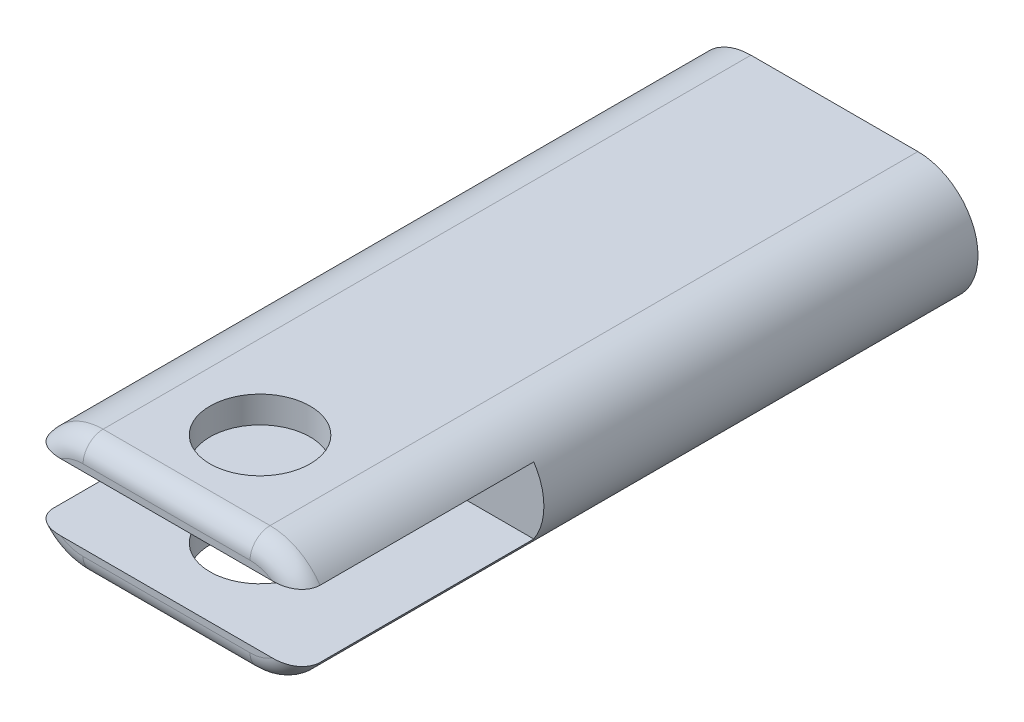
from build123d import *

# Parameters (mm, degrees)
BOSS_EXTRUDE1_DEPTH = 1000
FILLET1_R           = 30
SKETCH2_W           = 431.388380784
SKETCH2_H           = 100
CUT_EXTRUDE1_DEPTH  = 350
SKETCH3_R           = 75
CUT_EXTRUDE2_DEPTH  = 1039.568726775


with BuildPart() as part:
    # Sketch1 → Boss-Extrude1 (new body)
    with BuildSketch(Plane.XY):
        with BuildLine():
            Line((-125, 90), (125, 90))
            ThreePointArc((125, 90), (215, 0), (125, -90))
            Line((125, -90), (-125, -90))
            ThreePointArc((-125, -90), (-215, 0), (-125, 90))
        make_face()
    extrude(amount=BOSS_EXTRUDE1_DEPTH)

    # Fillet1
    fillet1_edges = [part.edges().sort_by_distance(p)[0] for p in [
        (-215, 0, 1000),
        (215, 0, 1000),
        (0, 90, 1000),
        (0, -90, 1000),
    ]]
    fillet(fillet1_edges, radius=FILLET1_R)

    # Sketch2 → Cut-Extrude1 (cut)
    with BuildSketch(Plane.XY.offset(1000)):
        with Locations((-0.091183766, 0)):
            Rectangle(SKETCH2_W, SKETCH2_H)
    extrude(amount=-CUT_EXTRUDE1_DEPTH, mode=Mode.SUBTRACT)

    # Sketch3 → Cut-Extrude2 (cut, through all)
    with BuildSketch(Plane(origin=(0, 90, 0), x_dir=(1, 0, 0), z_dir=(0, 1, 0))):
        with Locations((0, -860)):
            Circle(SKETCH3_R)
    extrude(amount=-CUT_EXTRUDE2_DEPTH, mode=Mode.SUBTRACT)


solid = part.part
